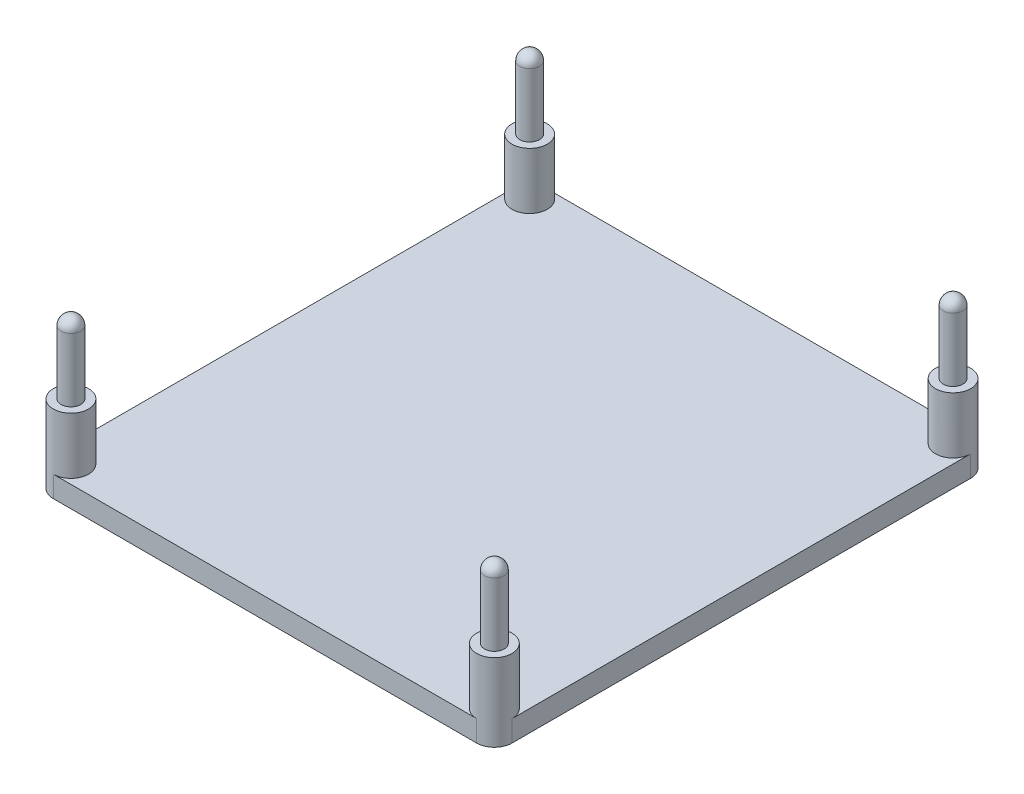
from build123d import *

# Parameters (mm, degrees)
SKETCH2_R             = 1.778
BOSS_EXTRUDE2_DEPTH   = 25.4
BOSS_EXTRUDE2_2_DEPTH = 25.4
BOSS_EXTRUDE2_3_DEPTH = 25.4
BOSS_EXTRUDE2_4_DEPTH = 25.4
SKETCH2_4_R           = 3.175
BOSS_EXTRUDE3_DEPTH   = 13.97
BOSS_EXTRUDE4_DEPTH   = 3.81
REVOLVE1_ANGLE        = 180
LPATTERN1_COUNT       = 2
LPATTERN1_PITCH       = 82.55
LPATTERN1_COUNT_DIR2  = 2
LPATTERN1_PITCH_DIR2  = 76.2


with BuildPart() as part:
    # Sketch2 → Boss-Extrude2 (new body)
    with BuildSketch(Plane(origin=(0, 0, 0), x_dir=(1, 0, 0), z_dir=(0, 1, 0))):
        with Locations((38.1, -41.275)):
            Circle(SKETCH2_R)
    extrude(amount=BOSS_EXTRUDE2_DEPTH)



with BuildPart() as body_2:
    # Sketch2 → Boss-Extrude2 2 (new body)
    with BuildSketch(Plane(origin=(0, 0, 0), x_dir=(1, 0, 0), z_dir=(0, 1, 0))):
        with Locations((-38.1, -41.275)):
            Circle(SKETCH2_R)
    extrude(amount=BOSS_EXTRUDE2_2_DEPTH)


with BuildPart() as body_3:
    # Sketch2 → Boss-Extrude2 3 (new body)
    with BuildSketch(Plane(origin=(0, 0, 0), x_dir=(1, 0, 0), z_dir=(0, 1, 0))):
        with Locations((38.1, 41.275)):
            Circle(SKETCH2_R)
    extrude(amount=BOSS_EXTRUDE2_3_DEPTH)


with BuildPart() as body_4:
    # Sketch2 → Boss-Extrude2 4 (new body)
    with BuildSketch(Plane(origin=(0, 0, 0), x_dir=(1, 0, 0), z_dir=(0, 1, 0))):
        with Locations((-38.1, 41.275)):
            Circle(SKETCH2_R)
    extrude(amount=BOSS_EXTRUDE2_4_DEPTH)


with BuildPart() as part_1:
    add(part.part)

    add(body_2.part)  # Boss-Extrude3 merges body 2

    add(body_3.part)  # Boss-Extrude3 merges body 3

    add(body_4.part)  # Boss-Extrude3 merges body 4
    # Sketch2<4> → Boss-Extrude3 (add)
    with BuildSketch(Plane(origin=(0, 0, 0), x_dir=(1, 0, 0), z_dir=(0, 1, 0))):
        with Locations((-38.1, 41.275)):
            Circle(SKETCH2_4_R)
        with Locations((38.1, 41.275)):
            Circle(SKETCH2_4_R)
        with Locations((38.1, -41.275)):
            Circle(SKETCH2_4_R)
        with Locations((-38.1, -41.275)):
            Circle(SKETCH2_4_R)
    extrude(amount=BOSS_EXTRUDE3_DEPTH)

    # Sketch2<5> → Boss-Extrude4 (add)
    with BuildSketch(Plane(origin=(0, 0, 0), x_dir=(1, 0, 0), z_dir=(0, 1, 0))):
        with BuildLine():
            Line((38.1, 44.45), (-38.1, 44.45))
            ThreePointArc((-38.1, 44.45), (-35.85493597, 43.52006403), (-34.925, 41.275))
            ThreePointArc((-34.925, 41.275), (-38.1, 38.1), (-41.275, 41.275))
            Line((-41.275, 41.275), (-41.275, -41.274999891))
            ThreePointArc((-41.275, -41.274999891), (-38.099999946, -38.1), (-34.925, -41.275))
            ThreePointArc((-34.925, -41.275), (-35.85493597, -43.52006403), (-38.1, -44.45))
            Line((-38.1, -44.45), (38.1, -44.45))
            ThreePointArc((38.1, -44.45), (35.85493597, -39.02993597), (41.275, -41.275))
            Line((41.275, -41.275), (41.275, 41.275))
            ThreePointArc((41.275, 41.275), (35.85493597, 39.02993597), (38.1, 44.45))
        make_face()
    extrude(amount=BOSS_EXTRUDE4_DEPTH)

    # Sketch3 → Revolve1 (revolve)
    with BuildSketch(Plane(origin=(0, 25.4, 0), x_dir=(1, 0, 0), z_dir=(0, 1, 0))):
        with BuildLine():
            Line((38.1, -39.497), (38.1, -43.053))
            ThreePointArc((38.1, -43.053), (39.878, -41.275), (38.1, -39.497))
        make_face()
    revolve1 = revolve(axis=Axis((38.1, 25.4, 39.497), (0, 0, 1)), revolution_arc=REVOLVE1_ANGLE)

    # LPattern1: Revolve1 2 × 2
    with Locations(*[(-j * LPATTERN1_PITCH_DIR2, 0, -i * LPATTERN1_PITCH) for i in range(LPATTERN1_COUNT) for j in range(LPATTERN1_COUNT_DIR2) if (i, j) != (0, 0)]):
        add(revolve1)


solid = part_1.part
